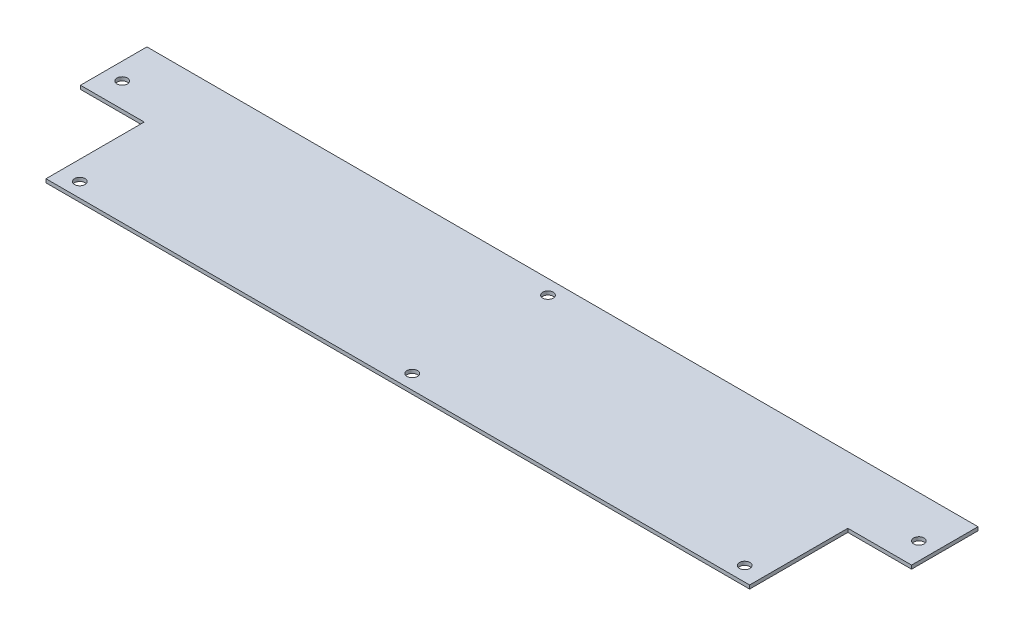
from build123d import *

# Parameters (mm, degrees)
SKETCH1_R           = 2.286
BOSS_EXTRUDE1_DEPTH = 1.5875


with BuildPart() as part:
    # Sketch1 → Boss-Extrude1 (new body)
    with BuildSketch(Plane(origin=(0, 0, 0), x_dir=(1, 0, 0), z_dir=(0, 1, 0))):
        Polygon((-154.686, -36.195), (-154.686, 6.985), (-182.708271591, 6.985), (-182.708271591, 36.195), (182.708271591, 36.195), (182.708271591, 6.985), (154.686, 6.985), (154.686, -36.195), align=None)
        with Locations((175.1457, 17.78)):
            Circle(SKETCH1_R, mode=Mode.SUBTRACT)
        with Locations((0, 29.845)):
            Circle(SKETCH1_R, mode=Mode.SUBTRACT)
        with Locations((146.177, -29.845)):
            Circle(SKETCH1_R, mode=Mode.SUBTRACT)
        with Locations((-175.1457, 17.78)):
            Circle(SKETCH1_R, mode=Mode.SUBTRACT)
        with Locations((0, -29.845)):
            Circle(SKETCH1_R, mode=Mode.SUBTRACT)
        with Locations((-146.177, -29.845)):
            Circle(SKETCH1_R, mode=Mode.SUBTRACT)
    extrude(amount=BOSS_EXTRUDE1_DEPTH)


solid = part.part
